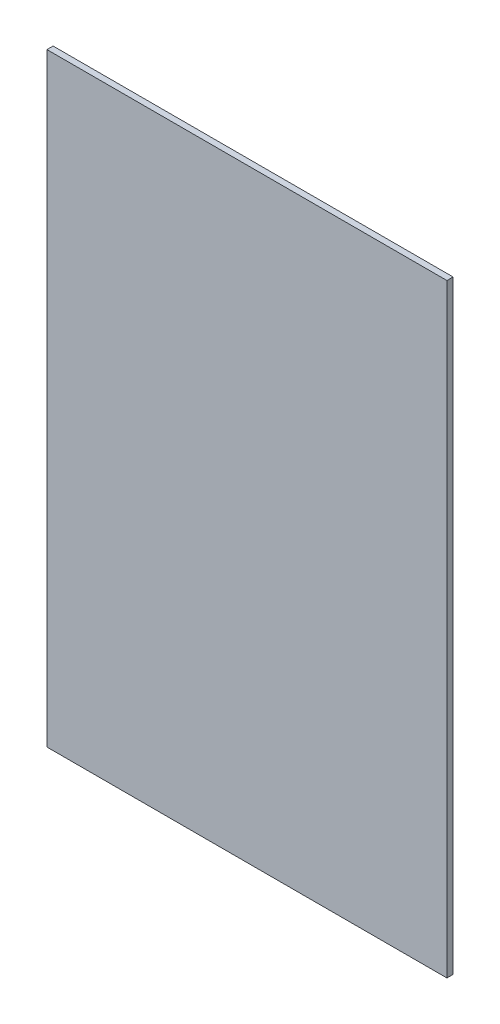
from build123d import *

# Parameters (mm, degrees)
SKETCH1_W      = 260
SKETCH1_H      = 392.6
EXTRUDE1_DEPTH = 4


with BuildPart() as part:
    # Sketch1 → Extrude1 (new body)
    with BuildSketch(Plane.XY):
        with Locations((0, -66.3)):
            Rectangle(SKETCH1_W, SKETCH1_H)
    extrude(amount=EXTRUDE1_DEPTH)


solid = part.part
